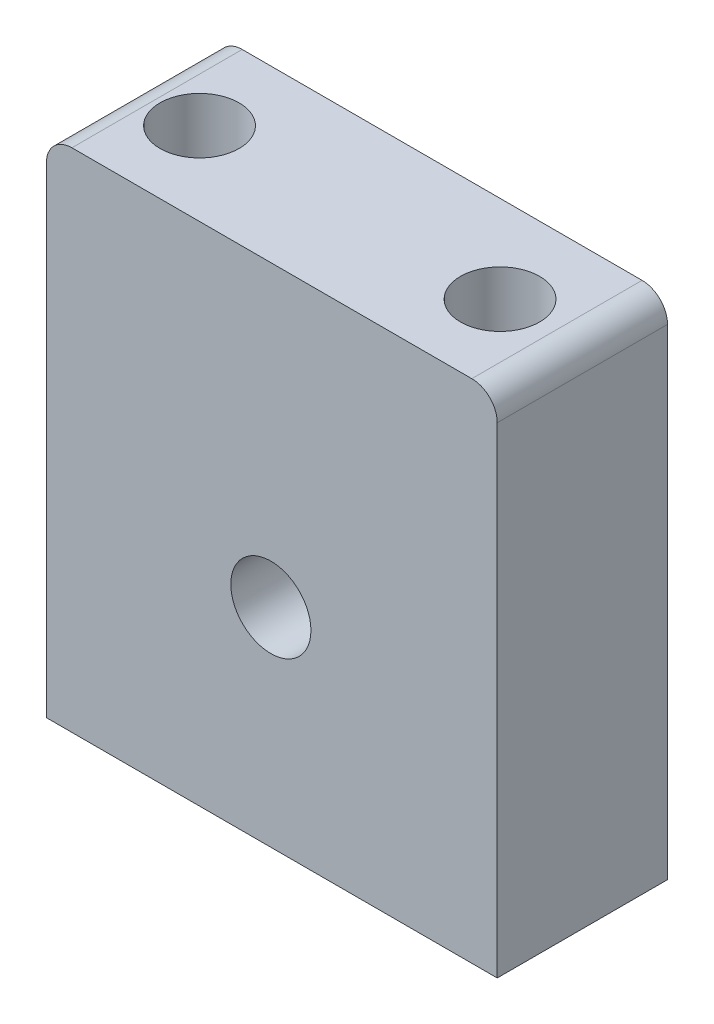
from build123d import *

# Parameters (mm, degrees)
SKETCH1_W           = 45
SKETCH1_H           = 50.8
SKETCH1_R           = 4
BOSS_EXTRUDE1_DEPTH = 17
SKETCH2_R           = 3.95
CUT_EXTRUDE1_DEPTH  = 17
FILLET1_R           = 2.54
SKETCH3_W           = 17
SKETCH3_H           = 0.254
CUT_EXTRUDE2_DEPTH  = 70.96170381


with BuildPart() as part:
    # Sketch1 → Boss-Extrude1 (new body)
    with BuildSketch(Plane.XY):
        with Locations((22.5, 25.4)):
            Rectangle(SKETCH1_W, SKETCH1_H)
        with Locations((22.4, 21)):
            Circle(SKETCH1_R, mode=Mode.SUBTRACT)
    extrude(amount=BOSS_EXTRUDE1_DEPTH)

    # Sketch2 → Cut-Extrude1 (cut)
    with BuildSketch(Plane(origin=(0, 50.8, 0), x_dir=(1, 0, 0), z_dir=(0, 1, 0))):
        with Locations((7, -8.718619698)):
            Circle(SKETCH2_R)
        with Locations((37, -8.718619698)):
            Circle(SKETCH2_R)
    extrude(amount=-CUT_EXTRUDE1_DEPTH, mode=Mode.SUBTRACT)

    # Fillet1
    fillet1_edges = [part.edges().sort_by_distance(p)[0] for p in [
        (0, 50.8, 8.5),
        (45, 50.8, 8.5),
    ]]
    fillet(fillet1_edges, radius=FILLET1_R)

    # Sketch3 → Cut-Extrude2 (cut, through all)
    with BuildSketch(Plane(origin=(45, 0, 0), x_dir=(0, 0, -1), z_dir=(1, 0, 0))):
        with Locations((-8.5, 0.127)):
            Rectangle(SKETCH3_W, SKETCH3_H)
    extrude(amount=-CUT_EXTRUDE2_DEPTH, mode=Mode.SUBTRACT)


solid = part.part
